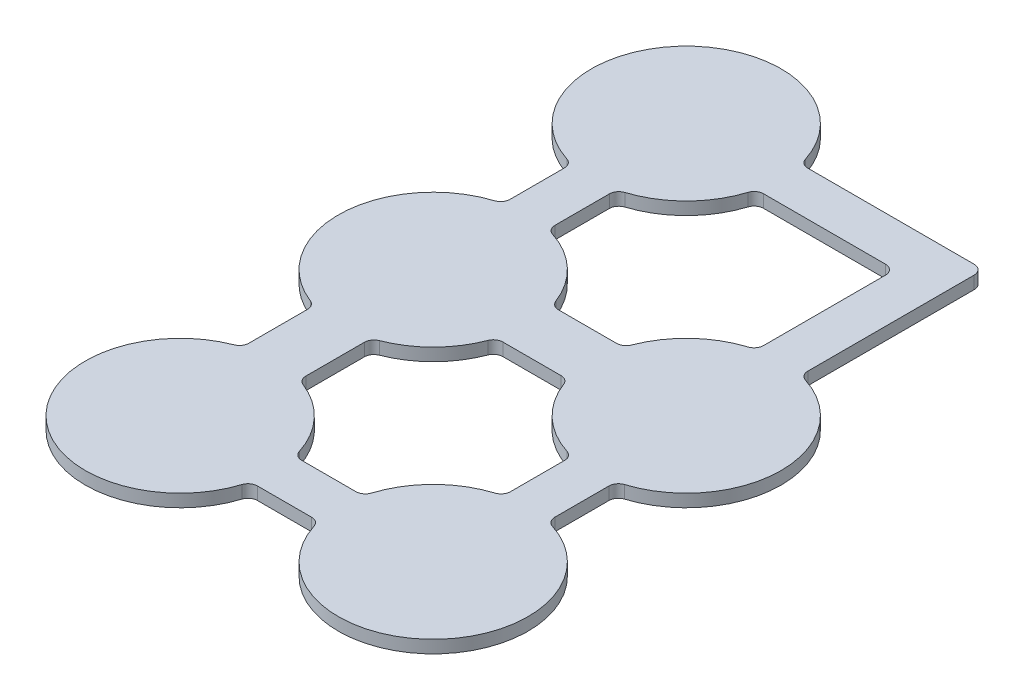
from build123d import *

# Parameters (mm, degrees)
BOSS_EXTRUDE1_DEPTH = 1
FILLET1_R           = 0.75


with BuildPart() as part:
    # Sketch1 → Boss-Extrude1 (new body)
    with BuildSketch(Plane(origin=(0, 0, 0), x_dir=(1, 0, 0), z_dir=(0, 1, 0))):
        with BuildLine():
            ThreePointArc((-2.707023927, 21.75), (-15.294199567, 25.312386558), (-11.775, 12.713068204))
            Line((-11.775, 12.713068204), (-11.775, 7.286931796))
            ThreePointArc((-11.775, 7.286931796), (-17.495946379, 0.246551985), (-12.25, -7.154544011))
            Line((-12.25, -7.154544011), (-12.25, -12.845455989))
            ThreePointArc((-12.25, -12.845455989), (-15.116700883, -25.483554693), (-2.707023927, -21.75))
            Line((-2.707023927, -21.75), (2.707023927, -21.75))
            ThreePointArc((2.707023927, -21.75), (15.303300859, -25.303300859), (11.75, -12.707023927))
            Line((11.75, -12.707023927), (11.75, -7.292976073))
            ThreePointArc((11.75, -7.292976073), (17.5, 0), (11.75, 7.292976073))
            Line((11.75, 7.292976073), (11.75, 21.75))
            Line((11.75, 21.75), (-2.707023927, 21.75))
        make_face()
        with BuildLine():
            ThreePointArc((-8.225, 12.713068204), (-4.687613442, 14.705800433), (-2.707023927, 18.25))
            Line((-2.707023927, 18.25), (8.25, 18.25))
            Line((8.25, 18.25), (8.25, 7.292976073))
            ThreePointArc((8.25, 7.292976073), (4.864190089, 5.465661585), (2.829923292, 2.2))
            Line((2.829923292, 2.2), (-2.829923292, 2.2))
            ThreePointArc((-2.829923292, 2.2), (-4.854825746, 5.456847249), (-8.225, 7.286931796))
            Line((-8.225, 7.286931796), (-8.225, 12.713068204))
        make_face(mode=Mode.SUBTRACT)
        with BuildLine():
            ThreePointArc((-7.75, -7.154544011), (-4.678220421, -5.284757527), (-2.829923292, -2.2))
            Line((-2.829923292, -2.2), (2.829923292, -2.2))
            ThreePointArc((2.829923292, -2.2), (4.864190089, -5.465661585), (8.25, -7.292976073))
            Line((8.25, -7.292976073), (8.25, -12.707023927))
            ThreePointArc((8.25, -12.707023927), (4.696699141, -14.696699141), (2.707023927, -18.25))
            Line((2.707023927, -18.25), (-2.707023927, -18.25))
            ThreePointArc((-2.707023927, -18.25), (-4.516445307, -14.883299117), (-7.75, -12.845455989))
            Line((-7.75, -12.845455989), (-7.75, -7.154544011))
        make_face(mode=Mode.SUBTRACT)
    extrude(amount=BOSS_EXTRUDE1_DEPTH)

    # Fillet1
    fillet1_edges = [part.edges().sort_by_distance(p)[0] for p in [
        (2.829923292, 0.5, -2.2),
        (-2.829923292, 0.5, -2.2),
        (11.75, 0.5, -21.75),
        (-2.707023927, 0.5, -21.75),
        (8.25, 0.5, -7.292976073),
        (11.75, 0.5, -7.292976073),
        (11.75, 0.5, 12.707023927),
        (2.707023927, 0.5, 21.75),
        (-2.707023927, 0.5, 21.75),
        (-2.707023927, 0.5, 18.25),
        (2.707023927, 0.5, 18.25),
        (8.25, 0.5, 12.707023927),
        (11.75, 0.5, 7.292976073),
        (-2.829923292, 0.5, 2.2),
        (2.829923292, 0.5, 2.2),
        (8.25, 0.5, 7.292976073),
        (-12.25, 0.5, 12.845455989),
        (-7.75, 0.5, 12.845455989),
        (-7.75, 0.5, 7.154544011),
        (-12.25, 0.5, 7.154544011),
        (-11.775, 0.5, -7.286931796),
        (-8.225, 0.5, -7.286931796),
        (8.25, 0.5, -18.25),
        (-2.707023927, 0.5, -18.25),
        (-8.225, 0.5, -12.713068204),
        (-11.775, 0.5, -12.713068204),
    ]]
    fillet(fillet1_edges, radius=FILLET1_R)


solid = part.part
